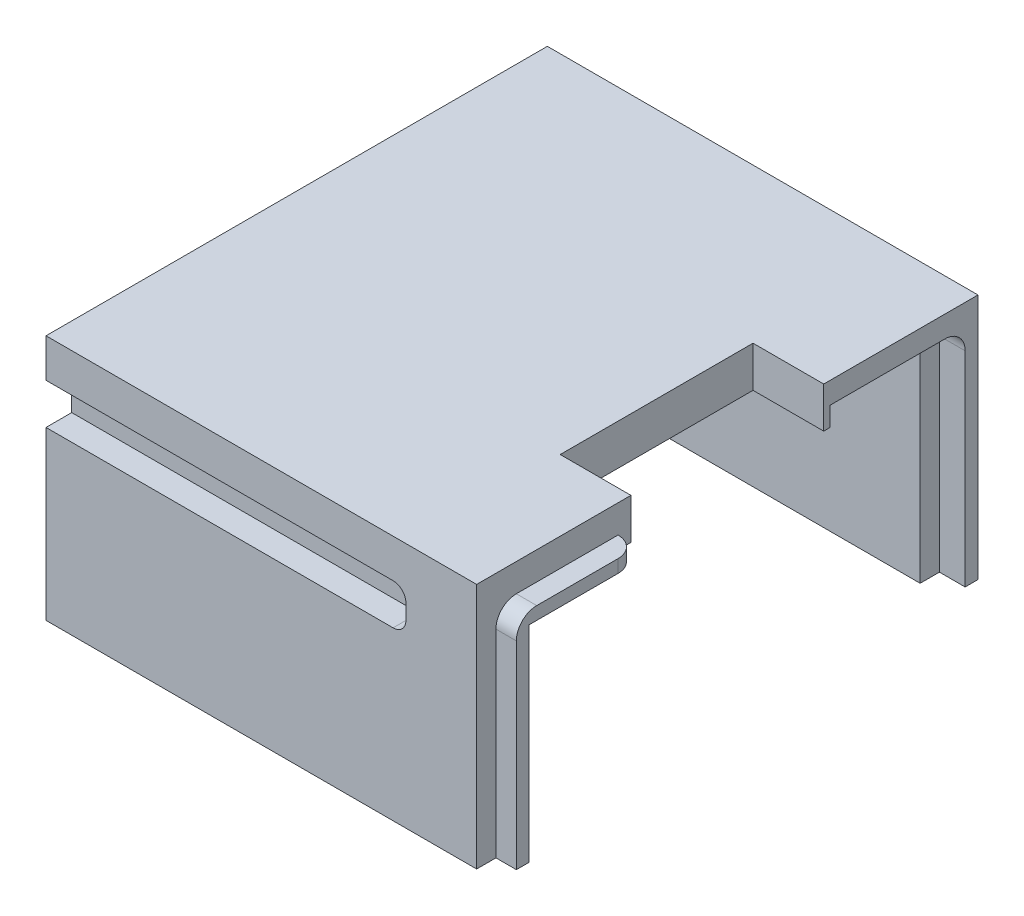
from build123d import *

# Parameters (mm, degrees)
WALL_DEPTH                = 16
ROOF_START                = 16
ROOF_DEPTH                = 3.175
F_2_56_TAPPED_HOLE1_D     = 1.778
F_2_56_TAPPED_HOLE1_DEPTH = 5.73
F_2_56_TAPPED_HOLE1_TIP   = 0.53416509
BOSS_EXTRUDE1_DEPTH       = 1.5875
CUT_EXTRUDE3_DEPTH        = 2
FILLET1_R                 = 1.5875
RAIL_CUT_DEPTH            = 56.855288749
RAIL_CUT_DEPTH_BACK       = 28
SKETCH4_W                 = 2
SKETCH4_H                 = 3.175
FILLET2_R                 = 1


with BuildPart() as part:
    # MainSketch → Wall (new body)
    with BuildSketch(Plane(origin=(0, 0, 0), x_dir=(1, 0, 0), z_dir=(0, 1, 0))):
        Polygon((-31, -2.5), (0, -2.5), (0, 0), (-33.5, 0), (-33.5, -39), (0, -39), (0, -36.5), (-31, -36.5), align=None)
    extrude(amount=WALL_DEPTH)

    # MainSketch<3> → Roof (add)
    with BuildSketch(Plane(origin=(0, 0, 0), x_dir=(1, 0, 0), z_dir=(0, 1, 0)).offset(ROOF_START)):
        Polygon((0, -12), (0, 0), (-33.5, 0), (-33.5, -39), (0, -39), (0, -27), (-5.5, -27), (-5.5, -12), align=None)
    extrude(amount=ROOF_DEPTH)

    # #2-56 Tapped Hole1
    with Locations(Plane(origin=(-16.75, 0, 37.75), x_dir=(0, 0, -1), z_dir=(0, -1, 0))):
        with Locations((0, 0), (36.5, 0)):
            Hole(F_2_56_TAPPED_HOLE1_D / 2, depth=F_2_56_TAPPED_HOLE1_DEPTH)
            with Locations((0, 0, -(F_2_56_TAPPED_HOLE1_DEPTH + F_2_56_TAPPED_HOLE1_TIP / 2))):  # 118° drill point
                Cone(0, F_2_56_TAPPED_HOLE1_D / 2, F_2_56_TAPPED_HOLE1_TIP, mode=Mode.SUBTRACT)

    # Sketch3 → Boss-Extrude1 (add)
    with BuildSketch(Plane(origin=(0, 0, 0), x_dir=(0, 0, -1), z_dir=(1, 0, 0))):
        Polygon((-28, 17), (-28, 16), (-36.5, 16), (-36.5, 0), (-37.5, 0), (-37.5, 17), align=None)
    extrude(amount=BOSS_EXTRUDE1_DEPTH)

    # Sketch3<3> → Cut-Extrude3 (cut)
    with BuildSketch(Plane(origin=(0, 0, 0), x_dir=(0, 0, -1), z_dir=(1, 0, 0))):
        Polygon((-11.5, 16), (-11.5, 17.5), (-1, 17.5), (-1, 0), (-2.5, 0), (-2.5, 16), align=None)
    extrude(amount=-CUT_EXTRUDE3_DEPTH, mode=Mode.SUBTRACT)

    # Fillet1
    fillet1_edges = [part.edges().sort_by_distance(p)[0] for p in [
        (0.79375, 17, 37.5),
        (1.5875, 16.5, 28),
        (-1, 17.5, 1),
        (-2, 16.75, 11.5),
    ]]
    fillet(fillet1_edges, radius=FILLET1_R - 0.0001)  # a hair under: the kernel refuses the full size

    # Sketch4 → rail cut (cut, two sides: drawn at the far end of the back side and taken through both)
    with BuildSketch(Plane.ZY.offset(33.5).offset(-RAIL_CUT_DEPTH_BACK)):
        with Locations((1, 14.5875)):
            Rectangle(SKETCH4_W, SKETCH4_H)
        with Locations((38, 14.5875)):
            Rectangle(SKETCH4_W, SKETCH4_H)
    extrude(amount=RAIL_CUT_DEPTH + RAIL_CUT_DEPTH_BACK, mode=Mode.SUBTRACT)

    # Fillet2
    fillet2_edges = [part.edges().sort_by_distance(p)[0] for p in [
        (-5.5, 16.175, 1),
        (-5.5, 13, 1),
        (-5.5, 13, 38),
        (-5.5, 16.175, 38),
        (-31, 8, 2.5),
        (-31, 8, 36.5),
    ]]
    fillet(fillet2_edges, radius=FILLET2_R)


solid = part.part
